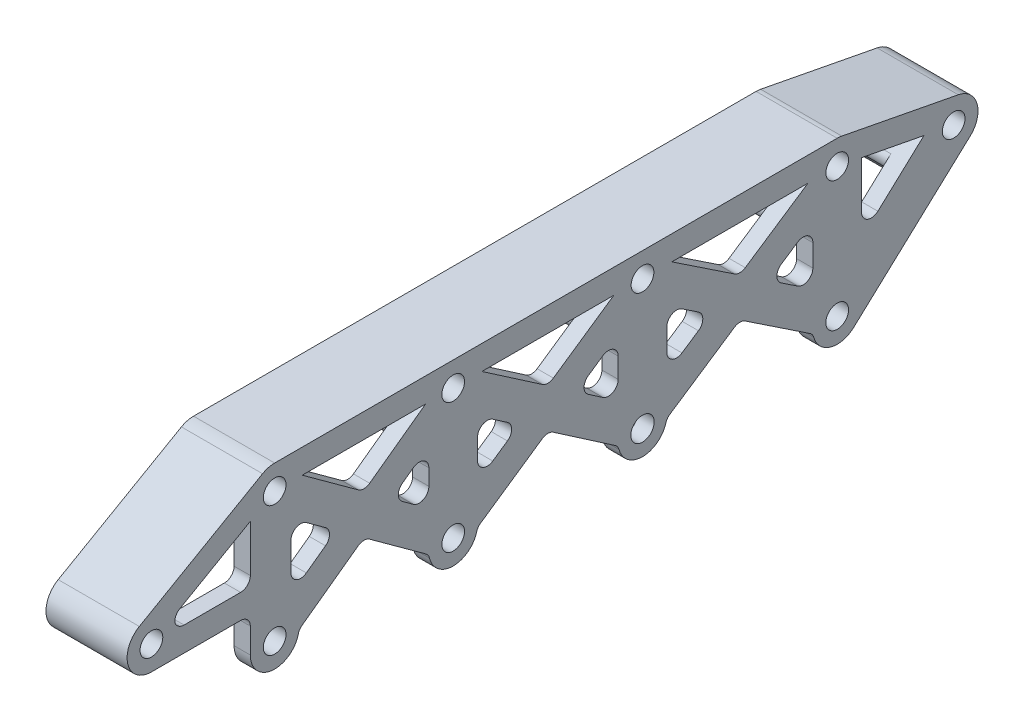
from build123d import *

# Parameters (mm, degrees)
SKETCH1_R           = 2.2225
SKETCH1_R_2         = 2.286
BOSS_EXTRUDE1_DEPTH = 15.875
CUT_EXTRUDE1_DEPTH  = 12.7
FILLET1_R           = 1.905
FILLET2_R           = 1.905


with BuildPart() as part:
    # Sketch1 → Boss-Extrude1 (new body)
    with BuildSketch(Plane(origin=(0, 0, 0), x_dir=(0, 0, -1), z_dir=(1, 0, 0))):
        with BuildLine():
            Line((-74.346371521, 29.531470489), (-98.459417669, 15.704719043))
            ThreePointArc((-98.459417669, 15.704719043), (-100.692415426, 10.347426782), (-96.090375983, 6.810748634))
            Line((-96.090375983, 6.810748634), (-76.739829975, 6.810748634))
            Line((-76.739829975, 6.810748634), (-76.739829975, 0))
            ThreePointArc((-76.739829975, 0), (-72.217829804, -4.756423665), (-67.239119809, -0.480385964))
            Line((-67.239119809, -0.480385964), (-54.510831234, 8.774431919))
            Line((-54.510831234, 8.774431919), (-41.78254266, -0.480385964))
            ThreePointArc((-41.78254266, -0.480385964), (-37.110165264, -4.76204497), (-32.321212708, -0.61118388))
            Line((-32.321212708, -0.61118388), (-18.522166247, 8.850338477))
            Line((-18.522166247, 8.850338477), (-4.723119786, -0.61118388))
            ThreePointArc((-4.723119786, -0.61118388), (-0.031045532, -4.76239881), (4.71475024, -0.672708273))
            Line((4.71475024, -0.672708273), (19.05, 8.8841249))
            Line((19.05, 8.8841249), (33.38524976, -0.672708273))
            ThreePointArc((33.38524976, -0.672708273), (36.50219731, -4.486472201), (41.328163437, -3.501480697))
            Line((41.328163437, -3.501480697), (64.118224938, 17.509644548))
            ThreePointArc((64.118224938, 17.509644548), (65.470652676, 22.314808119), (61.790668135, 25.687695828))
            Line((61.790668135, 25.687695828), (39.000606781, 30.076570718))
            ThreePointArc((39.000606781, 30.076570718), (38.552348432, 30.140969009), (38.1, 30.1625))
            Line((38.1, 30.1625), (-71.977329975, 30.1625))
            ThreePointArc((-71.977329975, 30.1625), (-73.203151749, 30.002039464), (-74.346371521, 29.531470489))
        make_face()
        with Locations((-71.977329975, 0)):
            Circle(SKETCH1_R, mode=Mode.SUBTRACT)
        with Locations((-37.044332494, 0)):
            Circle(SKETCH1_R, mode=Mode.SUBTRACT)
        Circle(SKETCH1_R_2, mode=Mode.SUBTRACT)
        with Locations((38.1, 0)):
            Circle(SKETCH1_R, mode=Mode.SUBTRACT)
        with Locations((-96.090375983, 11.573248634)):
            Circle(SKETCH1_R, mode=Mode.SUBTRACT)
        with BuildLine():
            Line((-91.958905627, 13.942290412), (-76.739829975, 22.669117168))
            Line((-76.739829975, 22.669117168), (-76.739829975, 11.573248634))
            Line((-76.739829975, 11.573248634), (-91.327875983, 11.573248634))
            ThreePointArc((-91.327875983, 11.573248634), (-91.488336553, 12.799070538), (-91.958905627, 13.942290412))
        make_face(mode=Mode.SUBTRACT)
        Polygon((-68.802329975, 6.234130352), (-68.802329975, 19.165869648), (-59.909723356, 12.7), align=None, mode=Mode.SUBTRACT)
        Polygon((-49.111939113, 12.7), (-41.806832494, 18.011588512), (-41.806832494, 7.388411488), align=None, mode=Mode.SUBTRACT)
        Polygon((-32.281832494, 18.284859202), (-24.136660005, 12.7), (-32.281832494, 7.115140798), align=None, mode=Mode.SUBTRACT)
        with Locations((-71.977329975, 25.4)):
            Circle(SKETCH1_R, mode=Mode.SUBTRACT)
        Polygon((-54.510831234, 16.625568081), (-66.578437853, 25.4), (-42.443224615, 25.4), align=None, mode=Mode.SUBTRACT)
        Polygon((-31.429838736, 25.4), (-5.614493758, 25.4), (-18.522166247, 16.549661523), align=None, mode=Mode.SUBTRACT)
        with Locations((-37.044332494, 25.4)):
            Circle(SKETCH1_R, mode=Mode.SUBTRACT)
        Polygon((-4.7625, 18.284859202), (-4.7625, 7.115140798), (-12.907672489, 12.7), align=None, mode=Mode.SUBTRACT)
        Polygon((4.7625, 6.9908751), (4.7625, 18.4091249), (13.32618735, 12.7), align=None, mode=Mode.SUBTRACT)
        Polygon((24.77381265, 12.7), (33.3375, 18.4091249), (33.3375, 6.9908751), align=None, mode=Mode.SUBTRACT)
        Polygon((42.8625, 24.48284509), (55.078002072, 22.130402529), (42.8625, 10.868412562), align=None, mode=Mode.SUBTRACT)
        Polygon((5.72381265, 25.4), (32.37618735, 25.4), (19.05, 16.5158751), align=None, mode=Mode.SUBTRACT)
        with Locations((0, 25.4)):
            Circle(SKETCH1_R, mode=Mode.SUBTRACT)
        with Locations((60.890061354, 21.01112511)):
            Circle(SKETCH1_R, mode=Mode.SUBTRACT)
        with Locations((38.1, 25.4)):
            Circle(SKETCH1_R, mode=Mode.SUBTRACT)
    extrude(amount=BOSS_EXTRUDE1_DEPTH)

    # Sketch2 → Cut-Extrude1 (cut)
    with BuildSketch(Plane.ZY):
        with BuildLine():
            ThreePointArc((-19.05, -9.466612713), (-20.029843142, -7.164121716), (-20.732531201, -4.7625))
            Line((-20.732531201, -4.7625), (-38.1, -4.7625))
            ThreePointArc((-38.1, -4.7625), (-39.832859642, -4.436057226), (-41.328163584, -3.501480562))
            Line((-41.328163584, -3.501480562), (-56.571114764, 10.551643267))
            ThreePointArc((-56.571114764, 10.551643267), (-48.113312147, -18.768399935), (-19.05, -9.466612713))
        make_face()
        with BuildLine():
            Line((-32.37618735, 0), (-38.1, 0))
            Line((-38.1, 0), (-38.1, 4.7625))
            Line((-38.1, 4.7625), (-38.1, 19.05))
            Line((-38.1, 19.05), (-28.7837245, 19.123971007))
            ThreePointArc((-28.7837245, 19.123971007), (-44.370882809, 20.327205539), (-56.571114764, 10.551643267))
            Line((-56.571114764, 10.551643267), (-41.328163584, -3.501480562))
            ThreePointArc((-41.328163584, -3.501480562), (-39.832859642, -4.436057226), (-38.1, -4.7625))
            ThreePointArc((-38.1, -4.7625), (-34.9792923, -3.59758109), (-33.38524976, -0.672708273))
            Line((-33.38524976, -0.672708273), (-32.37618735, 0))
        make_face()
        with BuildLine():
            Line((-38.1, 19.05), (-38.1, 4.7625))
            Line((-38.1, 4.7625), (-25.23243735, 4.7625))
            Line((-25.23243735, 4.7625), (-19.448400811, 8.618524359))
            ThreePointArc((-19.448400811, 8.618524359), (-19.253870513, 9.044762381), (-19.05, 9.466612713))
            ThreePointArc((-19.05, 9.466612713), (-23.117425497, 15.101050212), (-28.7837245, 19.123971007))
            Line((-28.7837245, 19.123971007), (-38.1, 19.05))
        make_face()
        Polygon((-38.1, 4.7625), (-38.1, 0), (-32.37618735, 0), (-25.23243735, 4.7625), align=None)
        with BuildLine():
            Line((-21.2725, 0), (-32.37618735, 0))
            Line((-32.37618735, 0), (-33.38524976, -0.672708273))
            ThreePointArc((-33.38524976, -0.672708273), (-34.9792923, -3.59758109), (-38.1, -4.7625))
            Line((-38.1, -4.7625), (-20.732531201, -4.7625))
            ThreePointArc((-20.732531201, -4.7625), (-21.13707674, -2.396506444), (-21.2725, 0))
        make_face()
        with BuildLine():
            Line((-1e-09, -4.7625), (-17.367468799, -4.7625))
            ThreePointArc((-17.367468799, -4.7625), (-18.070156858, -7.164121716), (-19.05, -9.466612713))
            ThreePointArc((-19.05, -9.466612713), (-0.563237252, -21.265042207), (18.522166247, -10.461769151))
            ThreePointArc((18.522166247, -10.461769151), (17.211197715, -7.691945209), (16.311801293, -4.7625))
            Line((16.311801293, -4.7625), (-1e-09, -4.7625))
        make_face()
        with BuildLine():
            ThreePointArc((20.732531201, -4.7625), (19.833134779, -7.691945209), (18.522166247, -10.461769151))
            ThreePointArc((18.522166247, -10.461769151), (36.051943769, -21.249339304), (54.510831234, -12.142515308))
            ThreePointArc((54.510831234, -12.142515308), (52.524627628, -8.608811047), (51.244798774, -4.7625))
            Line((51.244798774, -4.7625), (37.044332489, -4.7625))
            Line((37.044332489, -4.7625), (20.732531201, -4.7625))
        make_face()
        with BuildLine():
            ThreePointArc((57.776863695, -4.7625), (56.497034841, -8.608811047), (54.510831234, -12.142515308))
            ThreePointArc((54.510831234, -12.142515308), (78.339843699, -20.298711175), (93.249829975, 0))
            ThreePointArc((93.249829975, 0), (92.968023551, 3.451092499), (92.130070714, 6.810748634))
            Line((92.130070714, 6.810748634), (76.739829975, 6.810748634))
            Line((76.739829975, 6.810748634), (76.739829975, 0))
            ThreePointArc((76.739829975, 0), (75.34492602, -3.367596045), (71.977329975, -4.7625))
            Line((71.977329975, -4.7625), (57.776863695, -4.7625))
        make_face()
        with BuildLine():
            ThreePointArc((89.826116273, 11.573248634), (78.563304531, 20.227313104), (64.364309957, 19.863564193))
            Line((64.364309957, 19.863564193), (71.977329975, 19.924011392))
            Line((71.977329975, 19.924011392), (71.977329975, 4.7625))
            Line((71.977329975, 4.7625), (71.977329975, 0))
            Line((71.977329975, 0), (66.578437853, 0))
            Line((66.578437853, 0), (67.239119809, -0.480385964))
            ThreePointArc((67.239119809, -0.480385964), (68.784089607, -3.533358488), (71.977329975, -4.7625))
            ThreePointArc((71.977329975, -4.7625), (75.34492602, -3.367596045), (76.739829975, 0))
            Line((76.739829975, 0), (76.739829975, 6.810748634))
            Line((76.739829975, 6.810748634), (76.739829975, 11.573248634))
            Line((76.739829975, 11.573248634), (89.826116273, 11.573248634))
        make_face()
        with BuildLine():
            Line((76.739829975, 6.810748634), (92.130070714, 6.810748634))
            ThreePointArc((92.130070714, 6.810748634), (91.12672594, 9.263902547), (89.826116273, 11.573248634))
            Line((89.826116273, 11.573248634), (76.739829975, 11.573248634))
            Line((76.739829975, 11.573248634), (76.739829975, 6.810748634))
        make_face()
        with BuildLine():
            ThreePointArc((89.826116273, 11.573248634), (91.12672594, 9.263902547), (92.130070714, 6.810748634))
            Line((92.130070714, 6.810748634), (95.640586153, 6.810748634))
            ThreePointArc((95.640586153, 6.810748634), (92.552341675, 8.353616609), (91.306683148, 11.573248634))
            Line((91.306683148, 11.573248634), (89.826116273, 11.573248634))
        make_face()
        with BuildLine():
            Line((71.977329975, 19.924011392), (64.364309957, 19.863564193))
            ThreePointArc((64.364309957, 19.863564193), (58.856765419, 16.744253999), (54.510831234, 12.142515308))
            ThreePointArc((54.510831234, 12.142515308), (56.038621959, 9.5779029), (57.192361516, 6.824674553))
            Line((57.192361516, 6.824674553), (60.028500825, 4.7625))
            Line((60.028500825, 4.7625), (71.977329975, 4.7625))
            Line((71.977329975, 4.7625), (71.977329975, 19.924011392))
        make_face()
        with BuildLine():
            Line((64.364309957, 19.863564193), (45.046091035, 19.710177993))
            ThreePointArc((45.046091035, 19.710177993), (50.32873733, 16.614567234), (54.510831234, 12.142515308))
            ThreePointArc((54.510831234, 12.142515308), (58.856765419, 16.744253999), (64.364309957, 19.863564193))
        make_face()
        Polygon((60.028500825, 4.7625), (66.578437853, 0), (71.977329975, 0), (71.977329975, 4.7625), align=None)
        with BuildLine():
            ThreePointArc((57.776863695, 4.7625), (58.181409234, 2.396506444), (58.316832494, 0))
            Line((58.316832494, 0), (66.578437853, 0))
            Line((66.578437853, 0), (60.028500825, 4.7625))
            Line((60.028500825, 4.7625), (57.776863695, 4.7625))
        make_face()
        with BuildLine():
            ThreePointArc((51.244798774, 4.7625), (50.840253235, 2.396506444), (50.704829975, 0))
            Line((50.704829975, 0), (58.316832494, 0))
            ThreePointArc((58.316832494, 0), (58.181409234, 2.396506444), (57.776863695, 4.7625))
            Line((57.776863695, 4.7625), (51.244798774, 4.7625))
        make_face()
        with BuildLine():
            Line((45.046091035, 19.710177993), (28.730605841, 19.580633427))
            ThreePointArc((28.730605841, 19.580633427), (22.872892611, 15.864726531), (18.522166247, 10.461769151))
            ThreePointArc((18.522166247, 10.461769151), (19.14461181, 9.27378536), (19.69095839, 8.048938683))
            Line((19.69095839, 8.048938683), (24.484026393, 4.7625))
            Line((24.484026393, 4.7625), (48.993161643, 4.7625))
            Line((48.993161643, 4.7625), (51.829300952, 6.824674553))
            ThreePointArc((51.829300952, 6.824674553), (52.98304051, 9.5779029), (54.510831234, 12.142515308))
            ThreePointArc((54.510831234, 12.142515308), (50.32873733, 16.614567234), (45.046091035, 19.710177993))
        make_face()
        with BuildLine():
            ThreePointArc((57.192361516, 6.824674553), (56.038621959, 9.5779029), (54.510831234, 12.142515308))
            ThreePointArc((54.510831234, 12.142515308), (52.98304051, 9.5779029), (51.829300952, 6.824674553))
            Line((51.829300952, 6.824674553), (54.510831234, 8.774431919))
            Line((54.510831234, 8.774431919), (57.192361516, 6.824674553))
        make_face()
        with BuildLine():
            ThreePointArc((58.316832494, 0), (58.181409234, -2.396506444), (57.776863695, -4.7625))
            Line((57.776863695, -4.7625), (71.977329975, -4.7625))
            ThreePointArc((71.977329975, -4.7625), (68.784089607, -3.533358488), (67.239119809, -0.480385964))
            Line((67.239119809, -0.480385964), (66.578437853, 0))
            Line((66.578437853, 0), (58.316832494, 0))
        make_face()
        with BuildLine():
            ThreePointArc((50.704829975, 0), (50.840253235, -2.396506444), (51.244798774, -4.7625))
            Line((51.244798774, -4.7625), (57.776863695, -4.7625))
            ThreePointArc((57.776863695, -4.7625), (58.181409234, -2.396506444), (58.316832494, 0))
            Line((58.316832494, 0), (50.704829975, 0))
        make_face()
        with BuildLine():
            ThreePointArc((51.244798774, -4.7625), (52.524627628, -8.608811047), (54.510831234, -12.142515308))
            ThreePointArc((54.510831234, -12.142515308), (56.497034841, -8.608811047), (57.776863695, -4.7625))
            Line((57.776863695, -4.7625), (51.244798774, -4.7625))
        make_face()
        with BuildLine():
            ThreePointArc((41.78254266, -0.480385964), (40.23757286, -3.533358489), (37.044332489, -4.7625))
            Line((37.044332489, -4.7625), (51.244798774, -4.7625))
            ThreePointArc((51.244798774, -4.7625), (50.840253235, -2.396506444), (50.704829975, 0))
            Line((50.704829975, 0), (42.443224615, 0))
            Line((42.443224615, 0), (41.78254266, -0.480385964))
        make_face()
        with BuildLine():
            Line((42.443224615, 0), (50.704829975, 0))
            ThreePointArc((50.704829975, 0), (50.840253235, 2.396506444), (51.244798774, 4.7625))
            Line((51.244798774, 4.7625), (48.993161643, 4.7625))
            Line((48.993161643, 4.7625), (42.443224615, 0))
        make_face()
        with BuildLine():
            Line((54.510831234, 8.774431919), (51.829300952, 6.824674553))
            ThreePointArc((51.829300952, 6.824674553), (51.511060358, 5.800953734), (51.244798774, 4.7625))
            Line((51.244798774, 4.7625), (57.776863695, 4.7625))
            ThreePointArc((57.776863695, 4.7625), (57.51060211, 5.800953734), (57.192361516, 6.824674553))
            Line((57.192361516, 6.824674553), (54.510831234, 8.774431919))
        make_face()
        with BuildLine():
            Line((60.028500825, 4.7625), (57.192361516, 6.824674553))
            ThreePointArc((57.192361516, 6.824674553), (57.51060211, 5.800953734), (57.776863695, 4.7625))
            Line((57.776863695, 4.7625), (60.028500825, 4.7625))
        make_face()
        with BuildLine():
            ThreePointArc((51.244798774, 4.7625), (51.511060358, 5.800953734), (51.829300952, 6.824674553))
            Line((51.829300952, 6.824674553), (48.993161643, 4.7625))
            Line((48.993161643, 4.7625), (51.244798774, 4.7625))
        make_face()
        with BuildLine():
            Line((-8.986439081, 19.281160984), (-28.7837245, 19.123971007))
            ThreePointArc((-28.7837245, 19.123971007), (-23.117425497, 15.101050212), (-19.05, 9.466612713))
            ThreePointArc((-19.05, 9.466612713), (-14.852333774, 15.229164052), (-8.986439081, 19.281160984))
        make_face()
        with BuildLine():
            Line((8.679141464, 19.421425275), (-8.986439081, 19.281160984))
            ThreePointArc((-8.986439081, 19.281160984), (-14.852333774, 15.229164052), (-19.05, 9.466612713))
            ThreePointArc((-19.05, 9.466612713), (-18.846129487, 9.044762381), (-18.651599189, 8.618524359))
            Line((-18.651599189, 8.618524359), (-12.86756265, 4.7625))
            Line((-12.86756265, 4.7625), (12.5603061, 4.7625))
            Line((12.5603061, 4.7625), (17.353374103, 8.048938683))
            ThreePointArc((17.353374103, 8.048938683), (17.899720684, 9.27378536), (18.522166247, 10.461769151))
            ThreePointArc((18.522166247, 10.461769151), (14.319449876, 15.731262235), (8.679141464, 19.421425275))
        make_face()
        with BuildLine():
            Line((28.730605841, 19.580633427), (8.679141464, 19.421425275))
            ThreePointArc((8.679141464, 19.421425275), (14.319449876, 15.731262235), (18.522166247, 10.461769151))
            ThreePointArc((18.522166247, 10.461769151), (22.872892611, 15.864726531), (28.730605841, 19.580633427))
        make_face()
        with BuildLine():
            ThreePointArc((8.679141464, 19.421425275), (-0.168897822, 21.271829488), (-8.986439081, 19.281160984))
            Line((-8.986439081, 19.281160984), (8.679141464, 19.421425275))
        make_face()
        with BuildLine():
            ThreePointArc((45.046091035, 19.710177993), (36.875434672, 21.271829488), (28.730605841, 19.580633427))
            Line((28.730605841, 19.580633427), (45.046091035, 19.710177993))
        make_face()
        with BuildLine():
            ThreePointArc((-20.732531201, 4.7625), (-21.13707674, 2.396506444), (-21.2725, 0))
            Line((-21.2725, 0), (-16.8275, 0))
            ThreePointArc((-16.8275, 0), (-16.96292326, 2.396506444), (-17.367468799, 4.7625))
            Line((-17.367468799, 4.7625), (-20.732531201, 4.7625))
        make_face()
        with BuildLine():
            Line((-25.23243735, 4.7625), (-32.37618735, 0))
            Line((-32.37618735, 0), (-21.2725, 0))
            ThreePointArc((-21.2725, 0), (-21.13707674, 2.396506444), (-20.732531201, 4.7625))
            Line((-20.732531201, 4.7625), (-25.23243735, 4.7625))
        make_face()
        with BuildLine():
            ThreePointArc((-19.448400811, 8.618524359), (-20.182766295, 6.721249954), (-20.732531201, 4.7625))
            Line((-20.732531201, 4.7625), (-17.367468799, 4.7625))
            ThreePointArc((-17.367468799, 4.7625), (-17.917233705, 6.721249954), (-18.651599189, 8.618524359))
            Line((-18.651599189, 8.618524359), (-19.05, 8.8841249))
            Line((-19.05, 8.8841249), (-19.448400811, 8.618524359))
        make_face()
        with BuildLine():
            Line((-19.448400811, 8.618524359), (-25.23243735, 4.7625))
            Line((-25.23243735, 4.7625), (-20.732531201, 4.7625))
            ThreePointArc((-20.732531201, 4.7625), (-20.182766295, 6.721249954), (-19.448400811, 8.618524359))
        make_face()
        with BuildLine():
            ThreePointArc((-18.651599189, 8.618524359), (-17.917233705, 6.721249954), (-17.367468799, 4.7625))
            Line((-17.367468799, 4.7625), (-12.86756265, 4.7625))
            Line((-12.86756265, 4.7625), (-18.651599189, 8.618524359))
        make_face()
        with BuildLine():
            ThreePointArc((-17.367468799, 4.7625), (-16.96292326, 2.396506444), (-16.8275, 0))
            Line((-16.8275, 0), (-5.72381265, 0))
            Line((-5.72381265, 0), (-12.86756265, 4.7625))
            Line((-12.86756265, 4.7625), (-17.367468799, 4.7625))
        make_face()
        with BuildLine():
            Line((-17.367468799, -4.7625), (-20.732531201, -4.7625))
            ThreePointArc((-20.732531201, -4.7625), (-20.029843142, -7.164121716), (-19.05, -9.466612713))
            ThreePointArc((-19.05, -9.466612713), (-18.070156858, -7.164121716), (-17.367468799, -4.7625))
        make_face()
        with BuildLine():
            Line((-16.8275, 0), (-21.2725, 0))
            ThreePointArc((-21.2725, 0), (-21.13707674, -2.396506444), (-20.732531201, -4.7625))
            Line((-20.732531201, -4.7625), (-17.367468799, -4.7625))
            ThreePointArc((-17.367468799, -4.7625), (-16.96292326, -2.396506444), (-16.8275, 0))
        make_face()
        with BuildLine():
            Line((-5.72381265, 0), (-16.8275, 0))
            ThreePointArc((-16.8275, 0), (-16.96292326, -2.396506444), (-17.367468799, -4.7625))
            Line((-17.367468799, -4.7625), (-1e-09, -4.7625))
            ThreePointArc((-1e-09, -4.7625), (-3.120707701, -3.59758109), (-4.71475024, -0.672708273))
            Line((-4.71475024, -0.672708273), (-5.72381265, 0))
        make_face()
        with BuildLine():
            Line((15.771832494, 0), (5.614493758, 0))
            Line((5.614493758, 0), (4.723119786, -0.61118388))
            ThreePointArc((4.723119786, -0.61118388), (3.144093114, -3.577161548), (-1e-09, -4.7625))
            Line((-1e-09, -4.7625), (16.311801293, -4.7625))
            ThreePointArc((16.311801293, -4.7625), (15.907255754, -2.396506444), (15.771832494, 0))
        make_face()
        with BuildLine():
            Line((12.5603061, 4.7625), (5.614493758, 0))
            Line((5.614493758, 0), (15.771832494, 0))
            ThreePointArc((15.771832494, 0), (15.907255754, 2.396506444), (16.311801293, 4.7625))
            Line((16.311801293, 4.7625), (12.5603061, 4.7625))
        make_face()
        with BuildLine():
            ThreePointArc((21.2725, 0), (21.13707674, -2.396506444), (20.732531201, -4.7625))
            Line((20.732531201, -4.7625), (37.044332489, -4.7625))
            ThreePointArc((37.044332489, -4.7625), (33.900239378, -3.577161546), (32.321212708, -0.61118388))
            Line((32.321212708, -0.61118388), (31.429838736, 0))
            Line((31.429838736, 0), (21.2725, 0))
        make_face()
        with BuildLine():
            ThreePointArc((20.732531201, 4.7625), (21.13707674, 2.396506444), (21.2725, 0))
            Line((21.2725, 0), (31.429838736, 0))
            Line((31.429838736, 0), (24.484026393, 4.7625))
            Line((24.484026393, 4.7625), (20.732531201, 4.7625))
        make_face()
        with BuildLine():
            ThreePointArc((-19.05, 9.466612713), (-19.253870513, 9.044762381), (-19.448400811, 8.618524359))
            Line((-19.448400811, 8.618524359), (-19.05, 8.8841249))
            Line((-19.05, 8.8841249), (-18.651599189, 8.618524359))
            ThreePointArc((-18.651599189, 8.618524359), (-18.846129487, 9.044762381), (-19.05, 9.466612713))
        make_face()
        Polygon((-12.86756265, 4.7625), (-5.72381265, 0), (5.614493758, 0), (12.5603061, 4.7625), align=None)
        with BuildLine():
            ThreePointArc((20.732531201, 4.7625), (20.27843183, 6.4268545), (19.69095839, 8.048938683))
            Line((19.69095839, 8.048938683), (18.522166247, 8.850338477))
            Line((18.522166247, 8.850338477), (17.353374103, 8.048938683))
            ThreePointArc((17.353374103, 8.048938683), (16.765900664, 6.4268545), (16.311801293, 4.7625))
            Line((16.311801293, 4.7625), (20.732531201, 4.7625))
        make_face()
        with BuildLine():
            Line((17.353374103, 8.048938683), (12.5603061, 4.7625))
            Line((12.5603061, 4.7625), (16.311801293, 4.7625))
            ThreePointArc((16.311801293, 4.7625), (16.765900664, 6.4268545), (17.353374103, 8.048938683))
        make_face()
        with BuildLine():
            Line((24.484026393, 4.7625), (19.69095839, 8.048938683))
            ThreePointArc((19.69095839, 8.048938683), (20.27843183, 6.4268545), (20.732531201, 4.7625))
            Line((20.732531201, 4.7625), (24.484026393, 4.7625))
        make_face()
        with BuildLine():
            ThreePointArc((16.311801293, 4.7625), (15.907255754, 2.396506444), (15.771832494, 0))
            Line((15.771832494, 0), (21.2725, 0))
            ThreePointArc((21.2725, 0), (21.13707674, 2.396506444), (20.732531201, 4.7625))
            Line((20.732531201, 4.7625), (16.311801293, 4.7625))
        make_face()
        with BuildLine():
            Line((21.2725, 0), (15.771832494, 0))
            ThreePointArc((15.771832494, 0), (15.907255754, -2.396506444), (16.311801293, -4.7625))
            Line((16.311801293, -4.7625), (20.732531201, -4.7625))
            ThreePointArc((20.732531201, -4.7625), (21.13707674, -2.396506444), (21.2725, 0))
        make_face()
        with BuildLine():
            ThreePointArc((16.311801293, -4.7625), (17.211197715, -7.691945209), (18.522166247, -10.461769151))
            ThreePointArc((18.522166247, -10.461769151), (19.833134779, -7.691945209), (20.732531201, -4.7625))
            Line((20.732531201, -4.7625), (16.311801293, -4.7625))
        make_face()
        with BuildLine():
            ThreePointArc((19.69095839, 8.048938683), (19.14461181, 9.27378536), (18.522166247, 10.461769151))
            ThreePointArc((18.522166247, 10.461769151), (17.899720684, 9.27378536), (17.353374103, 8.048938683))
            Line((17.353374103, 8.048938683), (18.522166247, 8.850338477))
            Line((18.522166247, 8.850338477), (19.69095839, 8.048938683))
        make_face()
        Polygon((48.993161643, 4.7625), (24.484026393, 4.7625), (31.429838736, 0), (42.443224615, 0), align=None)
        with BuildLine():
            Line((5.614493758, 0), (-5.72381265, 0))
            Line((-5.72381265, 0), (-4.71475024, -0.672708273))
            ThreePointArc((-4.71475024, -0.672708273), (-3.120707701, -3.59758109), (-1e-09, -4.7625))
            ThreePointArc((-1e-09, -4.7625), (3.144093114, -3.577161548), (4.723119786, -0.61118388))
            Line((4.723119786, -0.61118388), (5.614493758, 0))
        make_face()
        with BuildLine():
            ThreePointArc((32.321212708, -0.61118388), (33.900239378, -3.577161546), (37.044332489, -4.7625))
            ThreePointArc((37.044332489, -4.7625), (40.23757286, -3.533358489), (41.78254266, -0.480385964))
            Line((41.78254266, -0.480385964), (42.443224615, 0))
            Line((42.443224615, 0), (31.429838736, 0))
            Line((31.429838736, 0), (32.321212708, -0.61118388))
        make_face()
    extrude(amount=-CUT_EXTRUDE1_DEPTH, mode=Mode.SUBTRACT)

    # Fillet1
    # the kernel refuses this fillet: 1.905 mm, written as the material it takes off along each edge
    with BuildSketch(Plane(origin=(12.7, 20.732531201, 76.739829975), x_dir=(0, 0.17442006441662436, -0.9846713366036917), z_dir=(-1, 0, 0))) as fillet1_piece_1:
        with BuildLine():
            CenterArc((2.242774535, -1.902573561), FILLET1_R, 92.892150763, 87.237994413)
            Line((0.337779449, -1.906900692), (0, 0))
            ThreePointArc((0, 0), (1.073327813, -0.027095234), (2.146655626, 0))
        make_face()
    extrude(amount=18.066639065, mode=Mode.SUBTRACT)
    with BuildSketch(Plane(origin=(-14.151136625, 19.75119605, 50.212108637), x_dir=(0, -0.007939726035938259, -0.999968479878478), z_dir=(1, 0, 0))) as fillet1_piece_2:
        with BuildLine():
            CenterArc((5.684099487, 1.833244354), FILLET1_R, 126.476050946, 127.748166679)
            Line((4.551602265, 3.36506518), (0, 0))
            Line((0, 0), (5.166180441, 0))
        make_face()
    extrude(amount=26.851136625, mode=Mode.SUBTRACT)
    with BuildSketch(Plane(origin=(12.7, 19.820213226, 58.90447418), x_dir=(0, 0.00793972603592667, 0.9999684798784781), z_dir=(-1, 0, 0))) as fillet1_piece_3:
        with BuildLine():
            CenterArc((5.875313763, 1.859178857), FILLET1_R, 125.566215802, 131.841704152)
            Line((4.767283033, 3.408789421), (0, 0))
            Line((0, 0), (5.460007877, 0))
        make_face()
    extrude(amount=27.351542759, mode=Mode.SUBTRACT)
    with BuildSketch(Plane(origin=(12.7, 19.534138802, 22.874842178), x_dir=(0, 0.007939726035908265, 0.9999684798784784), z_dir=(-1, 0, 0))) as fillet1_piece_4:
        with BuildLine():
            CenterArc((6.190519378, 1.875389868), FILLET1_R, 123.982148608, 135.902651787)
            Line((5.125749009, 3.455038266), (0, 0))
            Line((0, 0), (5.855948243, 0))
        make_face()
    extrude(amount=28.153679239, mode=Mode.SUBTRACT)
    with BuildSketch(Plane(origin=(-14.961148427, 19.465809762, 14.269144003), x_dir=(0, -0.007939726035888012, -0.9999684798784786), z_dir=(1, 0, 0))) as fillet1_piece_5:
        with BuildLine():
            CenterArc((5.998363865, 1.860755198), FILLET1_R, 124.891983752, 132.735289134)
            Line((4.90864458, 3.423296999), (0, 0))
            Line((0, 0), (5.590178743, 0))
        make_face()
    extrude(amount=27.661148427, mode=Mode.SUBTRACT)
    with BuildSketch(Plane(origin=(-15.327409343, 19.169650182, -23.030662623), x_dir=(0, -0.007939726035942443, -0.9999684798784781), z_dir=(1, 0, 0))) as fillet1_piece_6:
        with BuildLine():
            CenterArc((6.143363073, 1.86462637), FILLET1_R, 124.144985098, 134.037965415)
            Line((5.074107598, 3.441242281), (0, 0))
            Line((0, 0), (5.753243221, 0))
        make_face()
    extrude(amount=28.027409343, mode=Mode.SUBTRACT)
    with BuildSketch(Plane(origin=(12.7, 19.233624852, -14.973375372), x_dir=(0, 0.5547001962252253, 0.8320502943378463), z_dir=(-1, 0, 0))) as fillet1_piece_7:
        with BuildLine():
            CenterArc((6.324820434, -1.905), FILLET1_R, 90, 136.26300335)
            Line((5.007800405, -3.281402283), (0, 0))
            Line((0, 0), (6.324820434, 0))
        make_face()
    extrude(amount=28.512051085, mode=Mode.SUBTRACT)
    with BuildSketch(Plane(origin=(12.7, 20.732531201, -42.8625), x_dir=(0, 0.17381097849465976, 0.9847790329585258), z_dir=(-1, 0, 0)), Plane(origin=(12.7, 10.551643267, -56.571114764), x_dir=(0, 0.8418425013389814, 0.539723265145507), z_dir=(-1, 0, 0))) as fillet1_piece_8:
        with BuildLine():
            CenterArc((2.270232916, 1.902513744), FILLET1_R, 169.990528165, 97.08188169)
            Line((0.394228858, 2.233623658), (0, 0))
            ThreePointArc((0, 0), (1.08646861, 0.027763188), (2.172937219, 0))
        make_face()
    extrude(amount=18.370367625, mode=Mode.SUBTRACT)
    with BuildSketch(Plane(origin=(12.7, 17.55460439, -50.114787595), x_dir=(0, -0.606214040934826, -0.7953015381435329), z_dir=(-1, 0, 0))) as fillet1_piece_9:
        with BuildLine():
            CenterArc((2.270232916, -1.902513744), FILLET1_R, 92.927590144, 97.08188169)
            Line((0.394228858, -2.233623658), (0, 0))
            ThreePointArc((0, 0), (1.08646861, -0.027763188), (2.172937219, 0))
        make_face()
    extrude(amount=18.370367625, mode=Mode.SUBTRACT)

    # Fillet2
    # the kernel refuses this fillet: 1.905 mm, written as the material it adds along each edge
    with BuildSketch(Plane(origin=(12.7, 10.868412562, -42.8625), x_dir=(0, 1, 0), z_dir=(1, 0, 0))) as fillet2_piece_1:
        with BuildLine():
            CenterArc((FILLET2_R * 2.28208137786, -FILLET2_R), FILLET2_R, 90, 132.674274128)
            Line((FILLET2_R * 1.54686236232, -FILLET2_R * 1.67782962401), (0, 0))
            Line((0, 0), (FILLET2_R * 2.28208137786, 0))
        make_face()
    extrude(amount=3.175)
    with BuildSketch(Plane(origin=(12.7, 16.5158751, -19.05), x_dir=(0, 0.5547001962252253, 0.8320502943378463), z_dir=(1, 0, 0)), Plane(origin=(12.7, 8.8841249, -19.05), x_dir=(0, -0.5547001962252301, -0.832050294337843), z_dir=(1, 0, 0))) as fillet2_piece_2:
        with BuildLine():
            CenterArc((FILLET2_R * 0.666666666667, -FILLET2_R), FILLET2_R, 90, 67.380135052)
            Line((-FILLET2_R * 0.25641025641, -FILLET2_R * 0.615384615385), (0, 0))
            Line((0, 0), (FILLET2_R * 0.666666666667, 0))
        make_face()
    extrude(amount=3.175)
    with BuildSketch(Plane(origin=(0, 13.942290412, 91.958905627), x_dir=(0, -0.930226975401244, -0.3669847057247123), z_dir=(1, 0, 0))) as fillet2_piece_3:
        with BuildLine():
            CenterArc((1.650144324, 1.885042909), FILLET2_R, 188.300774799, 73.398450401)
            Line((-0.234898585, 1.610018855), (0, 0))
            ThreePointArc((0, 0), (0.687560135, 0.049892727), (1.37512027, 0))
        make_face()
    extrude(amount=15.875)
    with BuildSketch(Plane(origin=(0, 11.573248634, 91.327875983), x_dir=(0, 0.9895238368781006, 0.1443695821495718), z_dir=(1, 0, 0))) as fillet2_piece_4_section:
        with BuildLine():
            CenterArc((1.650144324, -1.885042909), FILLET2_R, 98.3007748, 73.398450401)
            Line((-0.234898585, -1.610018855), (0, 0))
            ThreePointArc((0, 0), (0.687560135, -0.049892727), (1.37512027, 0))
        make_face()
    fillet2_piece_4 = extrude(amount=15.875, mode=Mode.PRIVATE)
    fillet2_piece_4 = fillet2_piece_4 & Plane(origin=(6.35, 11.573248634, 96.090375983), x_dir=(0, -0.9955697751021079, -0.09402565024044443), z_dir=(-1, 0, 0)) * Cylinder(4.783692835, 39, mode=Mode.PRIVATE)
    add(fillet2_piece_4)
    with BuildSketch(Plane(origin=(-4.067660614, 11.573248634, 91.327875983), x_dir=(0, 0.9895238368781006, 0.1443695821495718), z_dir=(1, 0, 0))) as fillet2_piece_5_section:
        with BuildLine():
            CenterArc((1.650144324, -1.885042909), FILLET2_R, 98.3007748, 73.398450401)
            Line((-0.234898585, -1.610018855), (0, 0))
            ThreePointArc((0, 0), (0.687560135, -0.049892727), (1.37512027, 0))
        make_face()
    fillet2_piece_5 = extrude(amount=19.942660614, mode=Mode.PRIVATE)
    fillet2_piece_5 = split(fillet2_piece_5, bisect_by=Plane(origin=(12.7, 11.858253361, 90.956693286), z_dir=(1, 0, 0)), keep=Keep.TOP, mode=Mode.PRIVATE)
    add(fillet2_piece_5)
    with BuildSketch(Plane(origin=(12.7, 11.573248634, 76.739829975), x_dir=(0, 0, 1), z_dir=(1, 0, 0)), Plane(origin=(12.7, 6.810748634, 76.739829975), x_dir=(0, -1, 0), z_dir=(1, 0, 0))) as fillet2_piece_6:
        with BuildLine():
            CenterArc((FILLET2_R, -FILLET2_R), FILLET2_R, 90, 90)
            Line((0, -FILLET2_R), (0, 0))
            Line((0, 0), (FILLET2_R, 0))
        make_face()
    extrude(amount=3.175)
    with BuildSketch(Plane(origin=(12.7, 16.625568081, 54.510831234), x_dir=(0, 0.588083615763912, -0.8088001365418056), z_dir=(1, 0, 0))) as fillet2_piece_7:
        with BuildLine():
            CenterArc((FILLET2_R * 0.727106227106, FILLET2_R), FILLET2_R, 197.957733251, 72.042266749)
            Line((-FILLET2_R * 0.224177990349, FILLET2_R * 0.69168467826), (0, 0))
            Line((0, 0), (FILLET2_R * 0.727106227106, 0))
        make_face()
    extrude(amount=3.175)
    with BuildSketch(Plane(origin=(12.7, 12.7, 59.909723356), x_dir=(0, -0.5880836157639121, 0.8088001365418056), z_dir=(1, 0, 0))) as fillet2_piece_8:
        with BuildLine():
            CenterArc((FILLET2_R * 1.37531486146, -FILLET2_R), FILLET2_R, 90, 107.957733251)
            Line((FILLET2_R * 0.424030644005, -FILLET2_R * 1.30831532174), (0, 0))
            Line((0, 0), (FILLET2_R * 1.37531486146, 0))
        make_face()
    extrude(amount=3.175)
    with BuildSketch(Plane(origin=(12.7, 6.234130352, 68.802329975), x_dir=(0, 0.5880836157639131, -0.8088001365418048), z_dir=(1, 0, 0))) as fillet2_piece_9:
        with BuildLine():
            CenterArc((FILLET2_R * 1.96350562273, FILLET2_R), FILLET2_R, 143.978866626, 126.021133374)
            Line((FILLET2_R * 1.15470548619, FILLET2_R * 1.58808361576), (0, 0))
            Line((0, 0), (FILLET2_R * 1.96350562273, 0))
        make_face()
    extrude(amount=3.175)
    with BuildSketch(Plane(origin=(12.7, 19.165869648, 68.802329975), x_dir=(0, -0.5880836157639118, -0.8088001365418057), z_dir=(1, 0, 0)), Plane(origin=(12.7, 7.388411488, 41.806832494), x_dir=(0, 0.5880836157639128, 0.8088001365418052), z_dir=(1, 0, 0)), Plane(origin=(12.7, 18.011588512, 41.806832494), x_dir=(0, -1, 0), z_dir=(1, 0, 0))) as fillet2_piece_10:
        with BuildLine():
            CenterArc((FILLET2_R * 1.96350562273, -FILLET2_R), FILLET2_R, 90, 126.021133374)
            Line((FILLET2_R * 1.15470548619, -FILLET2_R * 1.58808361576), (0, 0))
            Line((0, 0), (FILLET2_R * 1.96350562273, 0))
        make_face()
    extrude(amount=3.175)
    with BuildSketch(Plane(origin=(12.7, 12.7, 49.111939113), x_dir=(0, -0.5880836157639139, -0.8088001365418044), z_dir=(1, 0, 0))) as fillet2_piece_11:
        with BuildLine():
            CenterArc((FILLET2_R * 1.37531486146, FILLET2_R), FILLET2_R, 162.042266749, 107.957733251)
            Line((FILLET2_R * 0.424030644005, FILLET2_R * 1.30831532174), (0, 0))
            Line((0, 0), (FILLET2_R * 1.37531486146, 0))
        make_face()
    extrude(amount=3.175)
    with BuildSketch(Plane(origin=(12.7, 12.7, 24.136660005), x_dir=(0, -0.5655006732656839, 0.824747833301827), z_dir=(1, 0, 0))) as fillet2_piece_12:
        with BuildLine():
            CenterArc((FILLET2_R * 1.45843828715, -FILLET2_R), FILLET2_R, 90, 111.12586764)
            Line((FILLET2_R * 0.52564737714, -FILLET2_R * 1.36041797707), (0, 0))
            Line((0, 0), (FILLET2_R * 1.45843828715, 0))
        make_face()
    extrude(amount=3.175)
    with BuildSketch(Plane(origin=(12.7, 18.284859202, 32.281832494), x_dir=(0, -0.5655006732656773, -0.8247478333018314), z_dir=(1, 0, 0)), Plane(origin=(12.7, 7.115140798, 4.7625), x_dir=(0, 0.5655006732656773, 0.8247478333018314), z_dir=(1, 0, 0)), Plane(origin=(12.7, 18.284859202, 4.7625), x_dir=(0, -1, 0), z_dir=(1, 0, 0))) as fillet2_piece_13:
        with BuildLine():
            CenterArc((FILLET2_R * 1.8981567578, -FILLET2_R), FILLET2_R, 90, 124.43706618)
            Line((FILLET2_R * 1.0734089245, -FILLET2_R * 1.56550067327), (0, 0))
            Line((0, 0), (FILLET2_R * 1.8981567578, 0))
        make_face()
    extrude(amount=3.175)
    with BuildSketch(Plane(origin=(12.7, 7.115140798, 32.281832494), x_dir=(0, 0.5655006732656749, -0.8247478333018332), z_dir=(1, 0, 0))) as fillet2_piece_14:
        with BuildLine():
            CenterArc((FILLET2_R * 1.8981567578, FILLET2_R), FILLET2_R, 145.56293382, 124.43706618)
            Line((FILLET2_R * 1.0734089245, FILLET2_R * 1.56550067327), (0, 0))
            Line((0, 0), (FILLET2_R * 1.8981567578, 0))
        make_face()
    extrude(amount=3.175)
    with BuildSketch(Plane(origin=(12.7, 16.549661523, 18.522166247), x_dir=(0, 0.565500673265678, 0.824747833301831), z_dir=(1, 0, 0)), Plane(origin=(12.7, 8.850338477, 18.522166247), x_dir=(0, -0.5655006732656785, -0.8247478333018305), z_dir=(1, 0, 0))) as fillet2_piece_15:
        with BuildLine():
            CenterArc((FILLET2_R * 0.685664939551, -FILLET2_R), FILLET2_R, 90, 68.87413236)
            Line((-FILLET2_R * 0.247125970462, -FILLET2_R * 0.639582022928), (0, 0))
            Line((0, 0), (FILLET2_R * 0.685664939551, 0))
        make_face()
    extrude(amount=3.175)
    with BuildSketch(Plane(origin=(12.7, 12.7, 12.907672489), x_dir=(0, -0.5655006732656779, -0.8247478333018311), z_dir=(1, 0, 0))) as fillet2_piece_16:
        with BuildLine():
            CenterArc((FILLET2_R * 1.45843828715, FILLET2_R), FILLET2_R, 158.87413236, 111.12586764)
            Line((FILLET2_R * 0.52564737714, FILLET2_R * 1.36041797707), (0, 0))
            Line((0, 0), (FILLET2_R * 1.45843828715, 0))
        make_face()
    extrude(amount=3.175)
    with BuildSketch(Plane(origin=(12.7, 12.7, -13.32618735), x_dir=(0, 0.5547001962252291, 0.8320502943378437), z_dir=(1, 0, 0))) as fillet2_piece_17:
        with BuildLine():
            CenterArc((FILLET2_R * 1.5, FILLET2_R), FILLET2_R, 157.380135052, 112.619864948)
            Line((FILLET2_R * 0.576923076923, FILLET2_R * 1.38461538462), (0, 0))
            Line((0, 0), (FILLET2_R * 1.5, 0))
        make_face()
    extrude(amount=3.175)
    with BuildSketch(Plane(origin=(12.7, 6.9908751, -4.7625), x_dir=(0, 1, 0), z_dir=(1, 0, 0)), Plane(origin=(12.7, 18.4091249, -4.7625), x_dir=(0, -0.5547001962252294, -0.8320502943378436), z_dir=(1, 0, 0)), Plane(origin=(12.7, 18.4091249, -33.3375), x_dir=(0, -1, 0), z_dir=(1, 0, 0))) as fillet2_piece_18:
        with BuildLine():
            CenterArc((FILLET2_R * 1.86851709182, -FILLET2_R), FILLET2_R, 90, 123.690067526)
            Line((FILLET2_R * 1.03646679748, -FILLET2_R * 1.55470019623), (0, 0))
            Line((0, 0), (FILLET2_R * 1.86851709182, 0))
        make_face()
    extrude(amount=3.175)
    with BuildSketch(Plane(origin=(12.7, 12.7, -24.77381265), x_dir=(0, 0.5547001962252226, -0.8320502943378482), z_dir=(1, 0, 0))) as fillet2_piece_19:
        with BuildLine():
            CenterArc((FILLET2_R * 1.5, -FILLET2_R), FILLET2_R, 90, 112.619864948)
            Line((FILLET2_R * 0.576923076923, -FILLET2_R * 1.38461538462), (0, 0))
            Line((0, 0), (FILLET2_R * 1.5, 0))
        make_face()
    extrude(amount=3.175)
    with BuildSketch(Plane(origin=(12.7, 6.9908751, -33.3375), x_dir=(0, 1, 0), z_dir=(1, 0, 0))) as fillet2_piece_20:
        with BuildLine():
            CenterArc((FILLET2_R * 1.86851709182, FILLET2_R), FILLET2_R, 146.309932474, 123.690067526)
            Line((FILLET2_R * 1.03646679748, FILLET2_R * 1.55470019623), (0, 0))
            Line((0, 0), (FILLET2_R * 1.86851709182, 0))
        make_face()
    extrude(amount=3.175)
    with BuildSketch(Plane(origin=(12.7, -0.480385964, 67.239119809), x_dir=(0, 0.5880836157638994, -0.8088001365418147), z_dir=(1, 0, 0)), Plane(origin=(12.7, -0.61118388, 32.321212708), x_dir=(0, 0.5655006732656759, -0.8247478333018325), z_dir=(1, 0, 0)), Plane(origin=(12.7, -0.672708273, -4.71475024), x_dir=(0, 0.5547001962252102, -0.8320502943378563), z_dir=(1, 0, 0))) as fillet2_piece_21:
        with BuildLine():
            CenterArc((0.768708972, -1.905), FILLET2_R, 90, 40.367593544)
            ThreePointArc((-0.46513871, -0.453571429), (-0.224826081, -0.234726463), (0, 0))
            Line((0, 0), (0.768708972, 0))
        make_face()
    extrude(amount=3.175)
    with BuildSketch(Plane(origin=(12.7, 8.774431919, 54.510831234), x_dir=(0, -0.5880836157639174, -0.8088001365418017), z_dir=(1, 0, 0))) as fillet2_piece_22:
        with BuildLine():
            CenterArc((FILLET2_R * 0.727106227106, -FILLET2_R), FILLET2_R, 90, 72.042266749)
            Line((-FILLET2_R * 0.224177990349, -FILLET2_R * 0.69168467826), (0, 0))
            Line((0, 0), (FILLET2_R * 0.727106227106, 0))
        make_face()
    extrude(amount=3.175)
    with BuildSketch(Plane(origin=(12.7, -0.480385964, 41.78254266), x_dir=(0, -0.9857028006568453, -0.16849329000660979), z_dir=(1, 0, 0)), Plane(origin=(12.7, -0.61118388, 4.723119786), x_dir=(0, -0.9806683330432183, -0.19567733789643482), z_dir=(1, 0, 0)), Plane(origin=(12.7, -0.672708273, -33.38524976), x_dir=(0, -0.9780339000329377, -0.20844589318660559), z_dir=(1, 0, 0))) as fillet2_piece_23:
        with BuildLine():
            CenterArc((0.77961319, -1.900563537), FILLET2_R, 93.91104578, 40.367593544)
            Line((-0.550359543, -0.536672952), (0, 0))
            ThreePointArc((0, 0), (0.324838829, -0.011091158), (0.649677659, 0))
        make_face()
    extrude(amount=3.175)


solid = part.part
